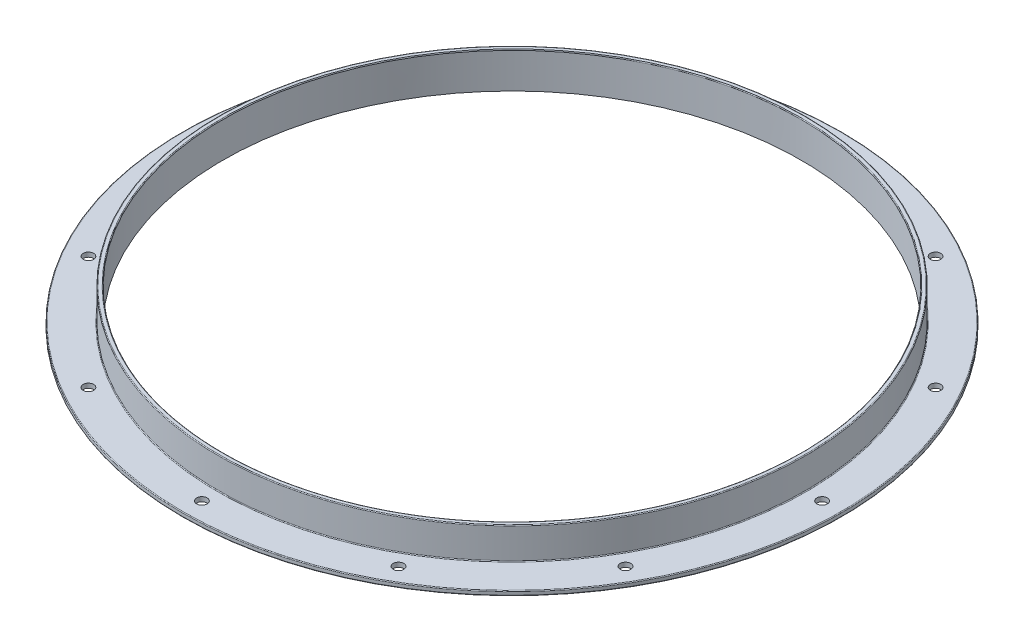
from build123d import *

# Parameters (mm, degrees)
FILLET3_R          = 0.79375
FILLET4_R          = 0.79375
SKETCH3_R          = 5.55625
CUT_EXTRUDE1_DEPTH = 496.037891525
CIRPATTERN1_COUNT  = 12


with BuildPart() as part:
    # Sketch1 → Revolve1 (revolve)
    with BuildSketch(Plane(origin=(0, 0, 0), x_dir=(0, 0, -1), z_dir=(1, 0, 0))):
        Polygon((306.3875, 0), (349.25, 0), (349.25, 4.7625), (311.15, 4.7625), (311.15, 38.1), (306.3875, 38.1), align=None)
    revolve(axis=Axis((0, 38.1, 0), (0, -1, 0)))

    # Fillet3
    fillet3_edges = [part.edges().sort_by_distance(p)[0] for p in [
        (0, 0, 349.25),
        (0, 4.7625, 349.25),
    ]]
    fillet(fillet3_edges, radius=FILLET3_R)

    # Fillet4
    fillet4_edges = [part.edges().sort_by_distance(p)[0] for p in [
        (0, 38.1, 311.15),
        (0, 4.7625, 311.15),
        (0, 38.1, 306.3875),
    ]]
    fillet(fillet4_edges, radius=FILLET4_R)

    # Sketch3 → Cut-Extrude1 (cut, through all)
    with BuildSketch(Plane(origin=(0, 4.7625, 0), x_dir=(-1, 0, 0), z_dir=(0, 1, 0))):
        with Locations((0, -328.6125)):
            Circle(SKETCH3_R)
    cut_extrude1 = extrude(amount=-CUT_EXTRUDE1_DEPTH, mode=Mode.SUBTRACT)

    # CirPattern1: Cut-Extrude1 ×12 about axis
    cirpattern1_axis = Axis((0, 38.1, 0), (0, 1, 0))
    for i in range(1, CIRPATTERN1_COUNT):
        add(cut_extrude1.rotate(cirpattern1_axis, i * 360 / CIRPATTERN1_COUNT), mode=Mode.SUBTRACT)


solid = part.part
